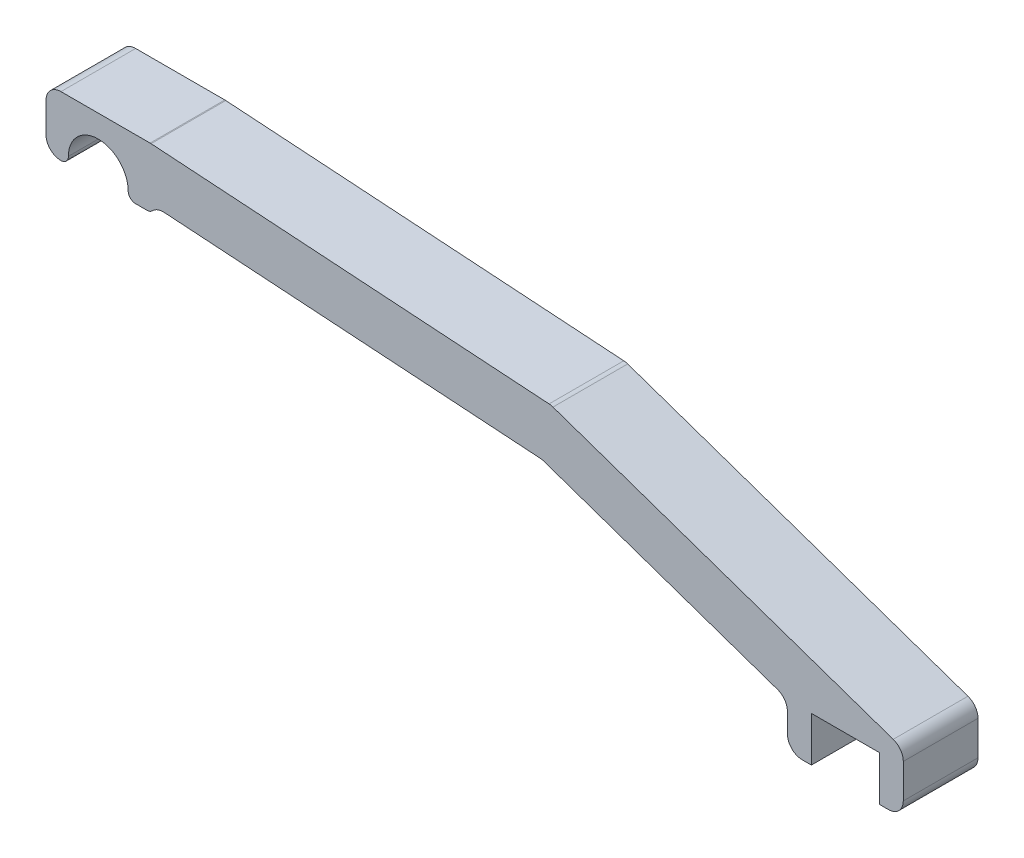
from build123d import *

# Parameters (mm, degrees)
EXTRUDE_1_DEPTH = 10
FILLET_1_R      = 2
FILLET_2_R      = 1


# Some blends are built 0.0001 mm under size
with BuildPart() as part:
    # Эскиз1 → Бобышка-Вытянуть1 (new body)
    with BuildSketch(Plane.XY):
        with BuildLine():
            ThreePointArc((3.872983346, -1), (0, 4), (-3.872983346, -1))
            Line((-3.872983346, -1), (-7, -1))
            Line((-7, -1), (-7, 7))
            Line((-7, 7), (7, 7))
            Line((7, 7), (7, -1))
            Line((7, -1), (3.872983346, -1))
        make_face()
        Polygon((7, 0.025778788), (59.392231378, -3.446827136), (60.607768622, 3.446827136), (7, 7), align=None)
        Polygon((59.392231378, -3.446827136), (92.245234414, -14.802793492), (92.245234414, -12.85), (107.754765586, -12.85), (60.607768622, 3.446827136), align=None)
        Polygon((104.55, -14.85), (104.55, -20.85), (107.754765586, -20.85), (107.754765586, -12.85), (92.245234414, -12.85), (92.245234414, -20.85), (95.45, -20.85), (95.45, -14.85), align=None)
    extrude(amount=EXTRUDE_1_DEPTH)

    # Скругление1
    # the kernel refuses this fillet: 2 mm, written as the material it adds along each edge
    with BuildSketch(Plane(origin=(59.392231378, -3.446827136, 0), x_dir=(0.9451302843245073, -0.32669365719688503, 0), z_dir=(0, 0, 1))) as fillet_1_piece_1:
        with BuildLine():
            CenterArc((FILLET_1_R * 0.134104869986, -FILLET_1_R), FILLET_1_R, 90, 15.276145222)
            Line((-FILLET_1_R * 0.129366569023, -FILLET_1_R * 0.0353328030732), (0, 0))
            Line((0, 0), (FILLET_1_R * 0.134104869986, 0))
        make_face()
    extrude(amount=10)
    with BuildSketch(Plane(origin=(7, 0.025778788, 0), x_dir=(0, -1, 0), z_dir=(0, 0, 1))) as fillet_1_piece_2:
        with BuildLine():
            CenterArc((2.115543143, 1.677025238), FILLET_1_R, 176.207928907, 60.775458648)
            Line((0.119921883, 1.809296875), (0, 0))
            Line((0, 0), (1.025778788, 0))
        make_face()
    extrude(amount=10)
    with BuildSketch(Plane(origin=(92.245234414, -14.802793492, 0), x_dir=(-0.945130284324508, 0.3266936571968835, 0), z_dir=(0, 0, 1))) as fillet_1_piece_3:
        with BuildLine():
            CenterArc((FILLET_1_R * 0.712395268642, FILLET_1_R), FILLET_1_R, 199.068216315, 70.931783685)
            Line((-FILLET_1_R * 0.232735015682, FILLET_1_R * 0.673306342803), (0, 0))
            Line((0, 0), (FILLET_1_R * 0.712395268642, 0))
        make_face()
    extrude(amount=10)
    # the kernel refuses this fillet: 2 mm, written as the material it takes off along each edge
    with BuildSketch(Plane(origin=(-7, -1, -5), x_dir=(1, 0, 0), z_dir=(0, 0, 1)), Plane(origin=(-7, 7, -5), x_dir=(0, -1, 0), z_dir=(0, 0, 1)), Plane(origin=(107.754765586, -20.85, -5), x_dir=(0, 1, 0), z_dir=(0, 0, 1)), Plane(origin=(92.245234414, -20.85, -5), x_dir=(1, 0, 0), z_dir=(0, 0, 1))) as fillet_1_2_piece_1:
        with BuildLine():
            CenterArc((FILLET_1_R, FILLET_1_R), FILLET_1_R, 180, 90)
            Line((0, FILLET_1_R), (0, 0))
            Line((0, 0), (FILLET_1_R, 0))
        make_face()
    extrude(amount=20, mode=Mode.SUBTRACT)
    with BuildSketch(Plane(origin=(107.754765586, -12.85, -3.561976343), x_dir=(-0.9451302843245086, 0.3266936571968812, 0), z_dir=(0, 0, 1))) as fillet_1_2_piece_2:
        with BuildLine():
            CenterArc((FILLET_1_R * 0.712395268642, FILLET_1_R), FILLET_1_R, 199.068216315, 70.931783685)
            Line((-FILLET_1_R * 0.232735015682, FILLET_1_R * 0.673306342803), (0, 0))
            Line((0, 0), (FILLET_1_R * 0.712395268642, 0))
        make_face()
    extrude(amount=17.123952686, mode=Mode.SUBTRACT)
    with BuildSketch(Plane(origin=(7, 7, -0.165520739), x_dir=(-1, 0, 0), z_dir=(0, 0, 1))) as fillet_1_2_piece_3:
        with BuildLine():
            CenterArc((FILLET_1_R * 0.0331041478527, FILLET_1_R), FILLET_1_R, 266.207928907, 3.792071093)
            Line((-FILLET_1_R * 0.0330316706273, FILLET_1_R * 0.00218936991332), (0, 0))
            Line((0, 0), (FILLET_1_R * 0.0331041478527, 0))
        make_face()
    extrude(amount=10.331041479, mode=Mode.SUBTRACT)
    with BuildSketch(Plane(origin=(60.607768622, 3.446827136, -0.67052435), x_dir=(-0.9978106300866822, 0.06613581847999181, 0), z_dir=(0, 0, 1))) as fillet_1_2_piece_4:
        with BuildLine():
            CenterArc((FILLET_1_R * 0.134104869986, FILLET_1_R), FILLET_1_R, 254.723854778, 15.276145222)
            Line((-FILLET_1_R * 0.129366569023, FILLET_1_R * 0.0353328030732), (0, 0))
            Line((0, 0), (FILLET_1_R * 0.134104869986, 0))
        make_face()
    extrude(amount=11.3410487, mode=Mode.SUBTRACT)

    # Скругление2
    fillet_2_edges = [part.edges().sort_by_distance(p)[0] for p in [
        (7, -1, 5),
        (3.872983346, -1, 5),
        (-3.872983346, -1, 5),
    ]]
    fillet(fillet_2_edges, radius=FILLET_2_R - 0.0001)  # a hair under: the kernel refuses the full size


solid = part.part
